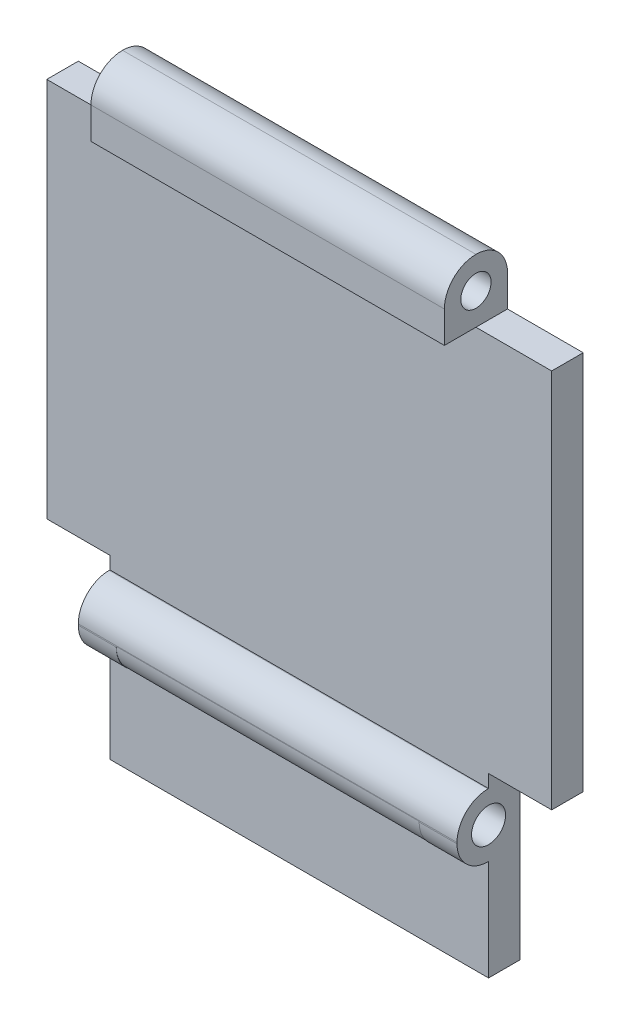
from build123d import *
from OCP.BRepAlgoAPI import BRepAlgoAPI_Cut
from OCP.TopTools import TopTools_ListOfShape
from OCP.BRepFilletAPI import BRepFilletAPI_MakeFillet

# Parameters (mm, degrees)
CROQUIS1_W              = 40
CROQUIS1_H              = 49.15
SALIENTE_EXTRUIR1_DEPTH = 5
CROQUIS5_W              = 6
CROQUIS5_H              = 4.995078359
CROQUIS5_H_2            = 5
CORTAR_EXTRUIR4_DEPTH   = 5
CROQUIS9_R              = 1.2
CORTAR_EXTRUIR8_DEPTH   = 32
REDONDEO1_R             = 2.5
CROQUIS12_W             = 39.999999512
CROQUIS12_H             = 44.15
CORTAR_EXTRUIR10_DEPTH  = 2.5
CROQUIS15_W             = 6
CROQUIS15_H             = 2.537629209
CORTAR_EXTRUIR11_DEPTH  = 0.01
CROQUIS17_W             = 2.5
CROQUIS17_H             = 4.997458943
SALIENTE_EXTRUIR2_DEPTH = 40
REDONDEO3_R             = 2.45
CROQUIS22_W             = 14
CROQUIS22_H             = 5
CORTAR_EXTRUIR13_DEPTH  = 5
CROQUIS25_W             = 5
CROQUIS25_H             = 7.03748993
CORTAR_EXTRUIR15_DEPTH  = 8
CROQUIS26_W             = 5
CROQUIS26_H             = 7
CORTAR_EXTRUIR16_DEPTH  = 8
CROQUIS29_W             = 5
CROQUIS29_H             = 4.997458943
SALIENTE_EXTRUIR3_DEPTH = 24
CROQUIS30_R             = 1.35
CORTAR_EXTRUIR17_DEPTH  = 24
REDONDEO4_R             = 2.5
REDONDEO4_R_2           = 2.4
CROQUIS31_W             = 2.5
CROQUIS31_H             = 4.997458943
CORTAR_EXTRUIR18_DEPTH  = 24
CROQUIS32_W             = 8.001194755
CROQUIS32_H             = 7
CORTAR_EXTRUIR19_DEPTH  = 2.5
CROQUIS33_W             = 8.001407562
CROQUIS33_H             = 6.993550445
CORTAR_EXTRUIR20_DEPTH  = 2.5
CROQUIS36_R             = 1.35
SALIENTE_EXTRUIR4_DEPTH = 3
SALIENTE_EXTRUIR5_START = 3
CROQUIS37_R             = 1.35
SALIENTE_EXTRUIR5_DEPTH = 3
REDONDEO5_R             = 2.45
REDONDEO6_R             = 2.45


# Some blends are built 0.0001 mm under size
with BuildPart() as part:
    # Croquis1 → Saliente-Extruir1 (new body)
    with BuildSketch(Plane.XY):
        Rectangle(CROQUIS1_W, CROQUIS1_H)
    extrude(amount=SALIENTE_EXTRUIR1_DEPTH)

    # Croquis5 → Cortar-Extruir4 (cut)
    with BuildSketch(Plane.XY):
        with Locations((-17, 22.077460821)):
            Rectangle(CROQUIS5_W, CROQUIS5_H)
        with Locations((17, 22.075)):
            Rectangle(CROQUIS5_W, CROQUIS5_H_2)
    extrude(amount=CORTAR_EXTRUIR4_DEPTH, mode=Mode.SUBTRACT)

    # Croquis9 → Cortar-Extruir8 (cut)
    with BuildSketch(Plane.ZY.offset(14)):
        with Locations((2.5, 22.075)):
            Circle(CROQUIS9_R)
    extrude(amount=-CORTAR_EXTRUIR8_DEPTH, mode=Mode.SUBTRACT)

    # Redondeo1
    redondeo1_edges = [part.edges().sort_by_distance(p)[0] for p in [
        (0, 24.575, 5),
        (0, 24.575, 0),
    ]]
    fillet(redondeo1_edges, radius=REDONDEO1_R - 0.0001)  # a hair under: the kernel refuses the full size


with BuildPart() as cortar_extruir10_tool:
    # Croquis12 → Cortar-Extruir10 (new body)
    with BuildSketch(Plane.XY.offset(5)):
        with Locations((2.44e-07, -2.5)):
            Rectangle(CROQUIS12_W, CROQUIS12_H)
    extrude(amount=-CORTAR_EXTRUIR10_DEPTH)


with BuildPart() as part_1:
    add(part.part)

    # Cortar-Extruir10: cut by cortar_extruir10_tool, with a tolerance
    cortar_extruir10_stock = TopTools_ListOfShape()
    cortar_extruir10_stock.Append(part_1.part.wrapped)
    cortar_extruir10_tools = TopTools_ListOfShape()
    cortar_extruir10_tools.Append(cortar_extruir10_tool.part.wrapped)
    cortar_extruir10_cut = BRepAlgoAPI_Cut()
    cortar_extruir10_cut.SetArguments(cortar_extruir10_stock)
    cortar_extruir10_cut.SetTools(cortar_extruir10_tools)
    cortar_extruir10_cut.SetFuzzyValue(0.00001)
    cortar_extruir10_cut.Build()
    add(Compound.cast(cortar_extruir10_cut.Shape()).solids(), mode=Mode.REPLACE)

    # Croquis15 → Cortar-Extruir11 (cut)
    with BuildSketch(Plane(origin=(0, 19.579921641, 0), x_dir=(1, 0, 0), z_dir=(0, 1, 0))):
        with Locations((-17, -3.768814605)):
            Rectangle(CROQUIS15_W, CROQUIS15_H)
    extrude(amount=-CORTAR_EXTRUIR11_DEPTH, mode=Mode.SUBTRACT)

    # Croquis17 → Saliente-Extruir2 (add)
    with BuildSketch(Plane.ZY.offset(20)):
        with Locations((-1.25, -14.076270529)):
            Rectangle(CROQUIS17_W, CROQUIS17_H)
    extrude(amount=-SALIENTE_EXTRUIR2_DEPTH)

    # Redondeo3
    redondeo3_edges = [part_1.edges().sort_by_distance(p)[0] for p in [
        (0, -16.575, -2.5),
        (0, -11.577541057, -2.5),
    ]]
    fillet(redondeo3_edges, radius=REDONDEO3_R)

    # Croquis22 → Cortar-Extruir13 (cut)
    with BuildSketch(Plane.XZ.offset(16.575)):
        with Locations((0, -2.5)):
            Rectangle(CROQUIS22_W, CROQUIS22_H)
    extrude(amount=-CORTAR_EXTRUIR13_DEPTH, mode=Mode.SUBTRACT)

    # Croquis25 → Cortar-Extruir15 (cut)
    with BuildSketch(Plane(origin=(20, 0, 0), x_dir=(0, 0, -1), z_dir=(1, 0, 0))):
        with Locations((0, -14.06270459)):
            Rectangle(CROQUIS25_W, CROQUIS25_H)
    extrude(amount=-CORTAR_EXTRUIR15_DEPTH, mode=Mode.SUBTRACT)

    # Croquis26 → Cortar-Extruir16 (cut)
    with BuildSketch(Plane.ZY.offset(20)):
        with Locations((0, -14.075)):
            Rectangle(CROQUIS26_W, CROQUIS26_H)
    extrude(amount=-CORTAR_EXTRUIR16_DEPTH, mode=Mode.SUBTRACT)

    # Croquis29 → Saliente-Extruir3 (add)
    with BuildSketch(Plane(origin=(12, 0, 0), x_dir=(0, 0, -1), z_dir=(1, 0, 0))):
        with Locations((-2.5, -14.076270529)):
            Rectangle(CROQUIS29_W, CROQUIS29_H)
    extrude(amount=-SALIENTE_EXTRUIR3_DEPTH)

    # Croquis30 → Cortar-Extruir17 (cut)
    with BuildSketch(Plane.ZY.offset(12)):
        with Locations((2.5, -14.076270528)):
            Circle(CROQUIS30_R)
    extrude(amount=-CORTAR_EXTRUIR17_DEPTH, mode=Mode.SUBTRACT)

    # Redondeo4
    redondeo4_edges_1 = [part_1.edges().sort_by_distance(p)[0] for p in [
        (0, -16.575, 5),
    ]]
    redondeo4_edges_2 = [part_1.edges().sort_by_distance(p)[0] for p in [
        (0, -11.577541057, 5),
    ]]
    redondeo4 = BRepFilletAPI_MakeFillet(part_1.part.solid().wrapped)
    for e in redondeo4_edges_1:
        redondeo4.Add(REDONDEO4_R - 0.0001, e.wrapped)
    for e in redondeo4_edges_2:
        redondeo4.Add(REDONDEO4_R_2 - 0.0001, e.wrapped)
    add(Compound.cast(redondeo4.Shape()), mode=Mode.REPLACE)  # a hair under: the kernel refuses the full size

    # Croquis31 → Cortar-Extruir18 (cut)
    with BuildSketch(Plane(origin=(12, 0, 0), x_dir=(0, 0, -1), z_dir=(1, 0, 0))):
        with Locations((1.25, -14.076270529)):
            Rectangle(CROQUIS31_W, CROQUIS31_H)
    extrude(amount=-CORTAR_EXTRUIR18_DEPTH, mode=Mode.SUBTRACT)

    # Croquis32 → Cortar-Extruir19 (cut)
    with BuildSketch(Plane.XY.offset(2.5)):
        with Locations((-16.000597378, -21.075)):
            Rectangle(CROQUIS32_W, CROQUIS32_H)
    extrude(amount=-CORTAR_EXTRUIR19_DEPTH, mode=Mode.SUBTRACT)

    # Croquis33 → Cortar-Extruir20 (cut)
    with BuildSketch(Plane.XY.offset(2.5)):
        with Locations((16.000703781, -21.078224778)):
            Rectangle(CROQUIS33_W, CROQUIS33_H)
    extrude(amount=-CORTAR_EXTRUIR20_DEPTH, mode=Mode.SUBTRACT)

    # Croquis36 → Saliente-Extruir4 (add)
    with BuildSketch(Plane(origin=(12, 0, 0), x_dir=(0, 0, -1), z_dir=(1, 0, 0))):
        Polygon((0, -24.575), (-2.5, -24.575), (-2.5, -16.575), (-5, -16.575), (-5, -11.576082189), (-2.5, -11.577541057), (-2.5, -10.543959625), (0, -10.543959625), align=None)
        with Locations(Location((-2.5, -14.076270528, 0), (0, 0, 180))):
            Circle(CROQUIS36_R, mode=Mode.SUBTRACT)
    extrude(amount=SALIENTE_EXTRUIR4_DEPTH)

    # Croquis37 → Saliente-Extruir5 (add)
    with BuildSketch(Plane.ZY.offset(12).offset(SALIENTE_EXTRUIR5_START)):
        Polygon((0, -24.575), (2.5, -24.575), (2.5, -16.575), (5, -16.575), (5, -11.57700903), (2.5, -11.577541057), (2.5, -10.575), (0, -10.575), align=None)
        with Locations((2.5, -14.076270528)):
            Circle(CROQUIS37_R, mode=Mode.SUBTRACT)
    extrude(amount=-SALIENTE_EXTRUIR5_DEPTH)

    # Redondeo5
    # the kernel refuses this fillet: 2.45 mm, written as the material it takes off along each edge
    with BuildSketch(Plane(origin=(-2.708580643, -11.576082189, 5), x_dir=(0, -1, 0), z_dir=(1, 0, 0))) as redondeo5_piece_1:
        with BuildLine():
            CenterArc((REDONDEO5_R * 1.00058371722, REDONDEO5_R), REDONDEO5_R, 179.966565226, 90.033434774)
            Line((REDONDEO5_R * 0.000583887478773, REDONDEO5_R * 1.00058354685), (-REDONDEO5_R * 0.019416109116, REDONDEO5_R * 1.00059521779))
            Line((-REDONDEO5_R * 0.019416109116, REDONDEO5_R * 1.00059521779), (-REDONDEO5_R * 0.0200116743443, -REDONDEO5_R * 0.02))
            Line((-REDONDEO5_R * 0.0200116743443, -REDONDEO5_R * 0.02), (REDONDEO5_R * 1.00058371722, -REDONDEO5_R * 0.02))
            Line((REDONDEO5_R * 1.00058371722, -REDONDEO5_R * 0.02), (REDONDEO5_R * 1.00058371722, 0))
        make_face()
    extrude(amount=32.417161286, mode=Mode.SUBTRACT)
    with BuildSketch(Plane(origin=(-2.7, -16.575, 5), x_dir=(0, 0, -1), z_dir=(1, 0, 0))) as redondeo5_piece_2:
        with BuildLine():
            CenterArc((REDONDEO5_R, REDONDEO5_R), REDONDEO5_R, 180, 90)
            Line((0, REDONDEO5_R), (-REDONDEO5_R * 0.02, REDONDEO5_R))
            Line((-REDONDEO5_R * 0.02, REDONDEO5_R), (-REDONDEO5_R * 0.02, -REDONDEO5_R * 0.02))
            Line((-REDONDEO5_R * 0.02, -REDONDEO5_R * 0.02), (REDONDEO5_R, -REDONDEO5_R * 0.02))
            Line((REDONDEO5_R, -REDONDEO5_R * 0.02), (REDONDEO5_R, 0))
        make_face()
    extrude(amount=32.4, mode=Mode.SUBTRACT)
    with BuildSketch(Plane(origin=(-29.703128651, -11.57700903, 5), x_dir=(0, -1, 0), z_dir=(1, 0, 0))) as redondeo5_piece_3:
        with BuildLine():
            CenterArc((REDONDEO5_R * 1.00021283342, REDONDEO5_R), REDONDEO5_R, 179.987806841, 90.012193159)
            Line((REDONDEO5_R * 0.000212856064231, REDONDEO5_R * 1.00021281077), (-REDONDEO5_R * 0.0197871434829, REDONDEO5_R * 1.00021706699))
            Line((-REDONDEO5_R * 0.0197871434829, REDONDEO5_R * 1.00021706699), (-REDONDEO5_R * 0.0200042566684, -REDONDEO5_R * 0.02))
            Line((-REDONDEO5_R * 0.0200042566684, -REDONDEO5_R * 0.02), (REDONDEO5_R * 1.00021283342, -REDONDEO5_R * 0.02))
            Line((REDONDEO5_R * 1.00021283342, -REDONDEO5_R * 0.02), (REDONDEO5_R * 1.00021283342, 0))
        make_face()
    extrude(amount=32.406257303, mode=Mode.SUBTRACT)

    # Redondeo6
    redondeo6_edges = [part_1.edges().sort_by_distance(p)[0] for p in [
        (-13.5, -16.575, 5),
    ]]
    fillet(redondeo6_edges, radius=REDONDEO6_R)


solid = part_1.part
